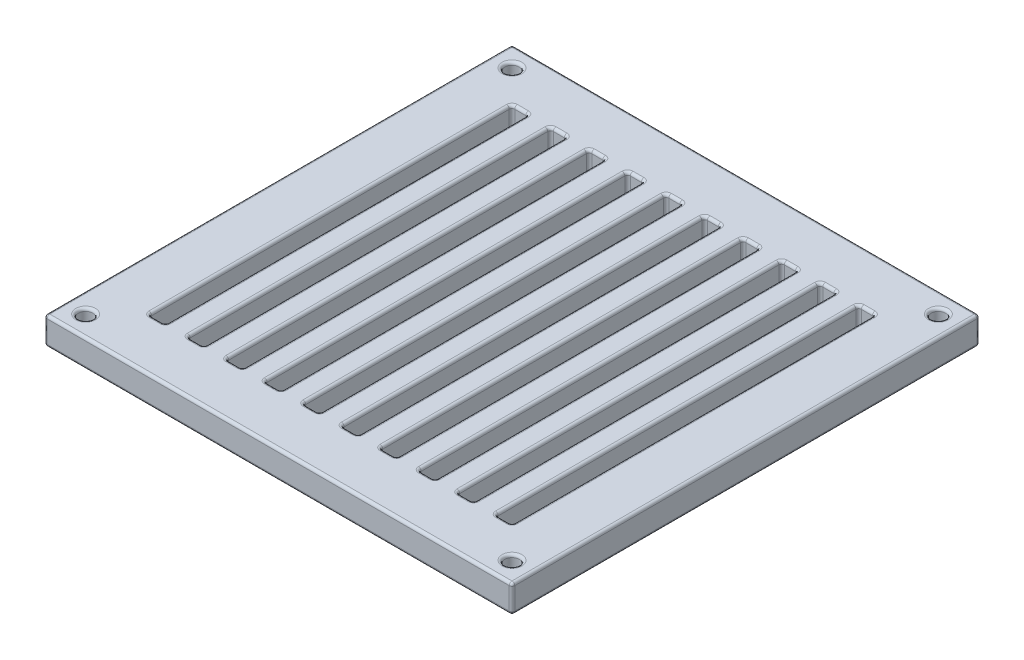
from build123d import *

# Parameters (mm, degrees)
SKETCH2_W              = 85
SKETCH2_H              = 85
BOSS_EXTRUDE1_DEPTH    = 5
SKETCH3_R              = 1.3
CUT_EXTRUDE1_DEPTH     = 121.312094155
LPATTERN1_COUNT        = 2
LPATTERN1_PITCH        = 77.5
LPATTERN1_COUNT_DIR2   = 2
LPATTERN1_PITCH_DIR2   = 77.5
SKETCH4_W              = 3
SKETCH4_H              = 66
CUT_EXTRUDE2_DEPTH     = 121.312094155
FILLET1_R              = 0.5
LPATTERN2_COUNT        = 10
LPATTERN2_PITCH        = 7
FILLET1_OF_LPATTERN2_R = 0.5
FILLET2_R              = 0.5
FILLET3_R              = 0.5


with BuildPart() as part:
    # Sketch2 → Boss-Extrude1 (new body)
    with BuildSketch(Plane(origin=(0, 0, 0), x_dir=(1, 0, 0), z_dir=(0, 1, 0))):
        with Locations((42.5, 42.5)):
            Rectangle(SKETCH2_W, SKETCH2_H)
    extrude(amount=BOSS_EXTRUDE1_DEPTH)

    # Sketch3 → Cut-Extrude1 (cut, through all)
    with BuildSketch(Plane(origin=(0, 5, 0), x_dir=(1, 0, 0), z_dir=(0, 1, 0))):
        with Locations(Location((3.75, 3.75, 0), (0, 0, 270))):
            Circle(SKETCH3_R)
    cut_extrude1 = extrude(amount=-CUT_EXTRUDE1_DEPTH, mode=Mode.SUBTRACT)

    # LPattern1: Cut-Extrude1 2 × 2
    with Locations(*[(i * LPATTERN1_PITCH, 0, -j * LPATTERN1_PITCH_DIR2) for i in range(LPATTERN1_COUNT) for j in range(LPATTERN1_COUNT_DIR2) if (i, j) != (0, 0)]):
        add(cut_extrude1, mode=Mode.SUBTRACT)

    # Sketch4 → Cut-Extrude2 (cut, through all)
    with BuildSketch(Plane(origin=(0, 5, 0), x_dir=(1, 0, 0), z_dir=(0, 1, 0))):
        with Locations((11, 42.5)):
            Rectangle(SKETCH4_W, SKETCH4_H)
    cut_extrude2 = extrude(amount=-CUT_EXTRUDE2_DEPTH, mode=Mode.SUBTRACT)

    # Fillet1
    fillet1_edges = [part.edges().sort_by_distance(p)[0] for p in [
        (9.5, 0, -42.5),
        (9.5, 2.5, -9.5),
        (11, 0, -75.5),
        (9.5, 2.5, -75.5),
        (12.5, 0, -42.5),
        (12.5, 2.5, -75.5),
        (11, 0, -9.5),
        (12.5, 2.5, -9.5),
        (9.5, 5, -42.5),
        (11, 5, -9.5),
        (12.5, 5, -42.5),
        (11, 5, -75.5),
    ]]
    fillet(fillet1_edges, radius=FILLET1_R)

    # LPattern2: Cut-Extrude2 ×10
    with Locations(*[(i * LPATTERN2_PITCH, 0, 0) for i in range(1, LPATTERN2_COUNT)]):
        add(cut_extrude2, mode=Mode.SUBTRACT)

    # Fillet1 of LPattern2
    fillet1_of_lpattern2_edges = [part.edges().sort_by_distance(p)[0] for p in [
        (16.5, 0, -42.5),
        (16.5, 2.5, -9.5),
        (18, 0, -75.5),
        (16.5, 2.5, -75.5),
        (19.5, 0, -42.5),
        (19.5, 2.5, -75.5),
        (18, 0, -9.5),
        (19.5, 2.5, -9.5),
        (16.5, 5, -42.5),
        (18, 5, -9.5),
        (19.5, 5, -42.5),
        (18, 5, -75.5),
        (23.5, 0, -42.5),
        (23.5, 2.5, -9.5),
        (25, 0, -75.5),
        (23.5, 2.5, -75.5),
        (26.5, 0, -42.5),
        (26.5, 2.5, -75.5),
        (25, 0, -9.5),
        (26.5, 2.5, -9.5),
        (23.5, 5, -42.5),
        (25, 5, -9.5),
        (26.5, 5, -42.5),
        (25, 5, -75.5),
        (30.5, 0, -42.5),
        (30.5, 2.5, -9.5),
        (32, 0, -75.5),
        (30.5, 2.5, -75.5),
        (33.5, 0, -42.5),
        (33.5, 2.5, -75.5),
        (32, 0, -9.5),
        (33.5, 2.5, -9.5),
        (30.5, 5, -42.5),
        (32, 5, -9.5),
        (33.5, 5, -42.5),
        (32, 5, -75.5),
        (37.5, 0, -42.5),
        (37.5, 2.5, -9.5),
        (39, 0, -75.5),
        (37.5, 2.5, -75.5),
        (40.5, 0, -42.5),
        (40.5, 2.5, -75.5),
        (39, 0, -9.5),
        (40.5, 2.5, -9.5),
        (37.5, 5, -42.5),
        (39, 5, -9.5),
        (40.5, 5, -42.5),
        (39, 5, -75.5),
        (44.5, 0, -42.5),
        (44.5, 2.5, -9.5),
        (46, 0, -75.5),
        (44.5, 2.5, -75.5),
        (47.5, 0, -42.5),
        (47.5, 2.5, -75.5),
        (46, 0, -9.5),
        (47.5, 2.5, -9.5),
        (44.5, 5, -42.5),
        (46, 5, -9.5),
        (47.5, 5, -42.5),
        (46, 5, -75.5),
        (51.5, 0, -42.5),
        (51.5, 2.5, -9.5),
        (53, 0, -75.5),
        (51.5, 2.5, -75.5),
        (54.5, 0, -42.5),
        (54.5, 2.5, -75.5),
        (53, 0, -9.5),
        (54.5, 2.5, -9.5),
        (51.5, 5, -42.5),
        (53, 5, -9.5),
        (54.5, 5, -42.5),
        (53, 5, -75.5),
        (58.5, 0, -42.5),
        (58.5, 2.5, -9.5),
        (60, 0, -75.5),
        (58.5, 2.5, -75.5),
        (61.5, 0, -42.5),
        (61.5, 2.5, -75.5),
        (60, 0, -9.5),
        (61.5, 2.5, -9.5),
        (58.5, 5, -42.5),
        (60, 5, -9.5),
        (61.5, 5, -42.5),
        (60, 5, -75.5),
        (65.5, 0, -42.5),
        (65.5, 2.5, -9.5),
        (67, 0, -75.5),
        (65.5, 2.5, -75.5),
        (68.5, 0, -42.5),
        (68.5, 2.5, -75.5),
        (67, 0, -9.5),
        (68.5, 2.5, -9.5),
        (65.5, 5, -42.5),
        (67, 5, -9.5),
        (68.5, 5, -42.5),
        (67, 5, -75.5),
        (72.5, 0, -42.5),
        (72.5, 2.5, -9.5),
        (74, 0, -75.5),
        (72.5, 2.5, -75.5),
        (75.5, 0, -42.5),
        (75.5, 2.5, -75.5),
        (74, 0, -9.5),
        (75.5, 2.5, -9.5),
        (72.5, 5, -42.5),
        (74, 5, -9.5),
        (75.5, 5, -42.5),
        (74, 5, -75.5),
    ]]
    fillet(fillet1_of_lpattern2_edges, radius=FILLET1_OF_LPATTERN2_R)

    # Fillet2
    fillet2_edges = [part.edges().sort_by_distance(p)[0] for p in [
        (85, 5, -42.5),
        (3.75, 0, -5.05),
        (3.75, 5, -5.05),
        (42.5, 5, -85),
        (81.25, 5, -5.05),
        (81.25, 0, -5.05),
        (3.75, 0, -82.55),
        (3.75, 5, -82.55),
        (81.25, 0, -82.55),
        (81.25, 5, -82.55),
        (0, 5, -42.5),
        (42.5, 0, -85),
        (85, 0, -42.5),
        (42.5, 0, 0),
        (0, 0, -42.5),
        (42.5, 5, 0),
    ]]
    fillet(fillet2_edges, radius=FILLET2_R)

    # Fillet3
    # the kernel refuses this fillet: 0.5 mm, written as the material it takes off along each edge
    with BuildSketch(Plane(origin=(0.5, 0.5, -84.5), x_dir=(-1, 0, 0), z_dir=(0, 0, -1))) as fillet3_piece_1_section:
        Polygon((0, 0), (FILLET3_R, 0), (FILLET3_R, -FILLET3_R), (0, -FILLET3_R), align=None)
    fillet3_piece_1 = extrude(amount=FILLET3_R, mode=Mode.PRIVATE)
    fillet3_piece_1 = fillet3_piece_1 - Plane(origin=(0.5, 0.5, -84.5), x_dir=(0.7071067811865475, 0.7071067811865475, 0), z_dir=(0, 0, -1)) * Sphere(FILLET3_R, mode=Mode.PRIVATE)
    add(fillet3_piece_1, mode=Mode.SUBTRACT)
    with BuildSketch(Plane(origin=(84.5, 0.5, -84.5), x_dir=(1, 0, 0), z_dir=(0, 0, -1))) as fillet3_piece_2_section:
        Polygon((0, 0), (FILLET3_R, 0), (FILLET3_R, FILLET3_R), (0, FILLET3_R), align=None)
    fillet3_piece_2 = extrude(amount=FILLET3_R, mode=Mode.PRIVATE)
    fillet3_piece_2 = fillet3_piece_2 - Plane(origin=(84.5, 0.5, -84.5), x_dir=(-0.7071067811865475, 0.7071067811865475, 0), z_dir=(0, 0, -1)) * Sphere(FILLET3_R, mode=Mode.PRIVATE)
    add(fillet3_piece_2, mode=Mode.SUBTRACT)
    with BuildSketch(Plane(origin=(0.5, 0.5, -0.5), x_dir=(0, 0, 1), z_dir=(-1, 0, 0))) as fillet3_piece_3_section:
        Polygon((0, 0), (FILLET3_R, 0), (FILLET3_R, -FILLET3_R), (0, -FILLET3_R), align=None)
    fillet3_piece_3 = extrude(amount=FILLET3_R, mode=Mode.PRIVATE)
    fillet3_piece_3 = fillet3_piece_3 - Plane(origin=(0.5, 0.5, -0.5), x_dir=(0, 0.7071067811865475, -0.7071067811865475), z_dir=(-1, 0, 0)) * Sphere(FILLET3_R, mode=Mode.PRIVATE)
    add(fillet3_piece_3, mode=Mode.SUBTRACT)
    with BuildSketch(Plane(origin=(84.5, 0.5, -0.5), x_dir=(0, 0, 1), z_dir=(1, 0, 0))) as fillet3_piece_4_section:
        Polygon((0, 0), (FILLET3_R, 0), (FILLET3_R, FILLET3_R), (0, FILLET3_R), align=None)
    fillet3_piece_4 = extrude(amount=FILLET3_R, mode=Mode.PRIVATE)
    fillet3_piece_4 = fillet3_piece_4 - Plane(origin=(84.5, 0.5, -0.5), x_dir=(0, 0.7071067811865475, -0.7071067811865475), z_dir=(1, 0, 0)) * Sphere(FILLET3_R, mode=Mode.PRIVATE)
    add(fillet3_piece_4, mode=Mode.SUBTRACT)
    with BuildSketch(Plane(origin=(84.5, 4.5, -0.5), x_dir=(0, 0, 1), z_dir=(1, 0, 0))) as fillet3_piece_5_section:
        Polygon((0, 0), (FILLET3_R, 0), (FILLET3_R, -FILLET3_R), (0, -FILLET3_R), align=None)
    fillet3_piece_5 = extrude(amount=FILLET3_R, mode=Mode.PRIVATE)
    fillet3_piece_5 = fillet3_piece_5 - Plane(origin=(84.5, 4.5, -0.5), x_dir=(0, -0.7071067811865475, -0.7071067811865475), z_dir=(1, 0, 0)) * Sphere(FILLET3_R, mode=Mode.PRIVATE)
    add(fillet3_piece_5, mode=Mode.SUBTRACT)
    with BuildSketch(Plane(origin=(0.5, 4.5, -0.5), x_dir=(0, 0, 1), z_dir=(-1, 0, 0))) as fillet3_piece_6_section:
        Polygon((0, 0), (FILLET3_R, 0), (FILLET3_R, FILLET3_R), (0, FILLET3_R), align=None)
    fillet3_piece_6 = extrude(amount=FILLET3_R, mode=Mode.PRIVATE)
    fillet3_piece_6 = fillet3_piece_6 - Plane(origin=(0.5, 4.5, -0.5), x_dir=(0, -0.7071067811865475, -0.7071067811865475), z_dir=(-1, 0, 0)) * Sphere(FILLET3_R, mode=Mode.PRIVATE)
    add(fillet3_piece_6, mode=Mode.SUBTRACT)
    with BuildSketch(Plane(origin=(84.5, 4.5, -84.5), x_dir=(1, 0, 0), z_dir=(0, 0, -1))) as fillet3_piece_7_section:
        Polygon((0, 0), (FILLET3_R, 0), (FILLET3_R, -FILLET3_R), (0, -FILLET3_R), align=None)
    fillet3_piece_7 = extrude(amount=FILLET3_R, mode=Mode.PRIVATE)
    fillet3_piece_7 = fillet3_piece_7 - Plane(origin=(84.5, 4.5, -84.5), x_dir=(-0.7071067811865475, -0.7071067811865475, 0), z_dir=(0, 0, -1)) * Sphere(FILLET3_R, mode=Mode.PRIVATE)
    add(fillet3_piece_7, mode=Mode.SUBTRACT)
    with BuildSketch(Plane(origin=(0.5, 4.5, -84.5), x_dir=(-1, 0, 0), z_dir=(0, 0, -1))) as fillet3_piece_8_section:
        Polygon((0, 0), (FILLET3_R, 0), (FILLET3_R, FILLET3_R), (0, FILLET3_R), align=None)
    fillet3_piece_8 = extrude(amount=FILLET3_R, mode=Mode.PRIVATE)
    fillet3_piece_8 = fillet3_piece_8 - Plane(origin=(0.5, 4.5, -84.5), x_dir=(0.7071067811865475, -0.7071067811865475, 0), z_dir=(0, 0, -1)) * Sphere(FILLET3_R, mode=Mode.PRIVATE)
    add(fillet3_piece_8, mode=Mode.SUBTRACT)
    with BuildSketch(Plane(origin=(85, 0.5, 0), x_dir=(0, 0, -1), z_dir=(0, 1, 0)), Plane(origin=(85, 0.5, -85), x_dir=(-1, 0, 0), z_dir=(0, 1, 0))) as fillet3_piece_9:
        with BuildLine():
            CenterArc((FILLET3_R, FILLET3_R), FILLET3_R, 180, 90)
            Line((0, FILLET3_R), (0, 0))
            Line((0, 0), (FILLET3_R, 0))
        make_face()
    extrude(amount=4, mode=Mode.SUBTRACT)
    with BuildSketch(Plane(origin=(0, 0.5, 0), x_dir=(0, 0, -1), z_dir=(0, 1, 0)), Plane(origin=(0, 0.5, -85), x_dir=(1, 0, 0), z_dir=(0, 1, 0))) as fillet3_piece_10:
        with BuildLine():
            CenterArc((FILLET3_R, -FILLET3_R), FILLET3_R, 90, 90)
            Line((0, -FILLET3_R), (0, 0))
            Line((0, 0), (FILLET3_R, 0))
        make_face()
    extrude(amount=4, mode=Mode.SUBTRACT)


solid = part.part
